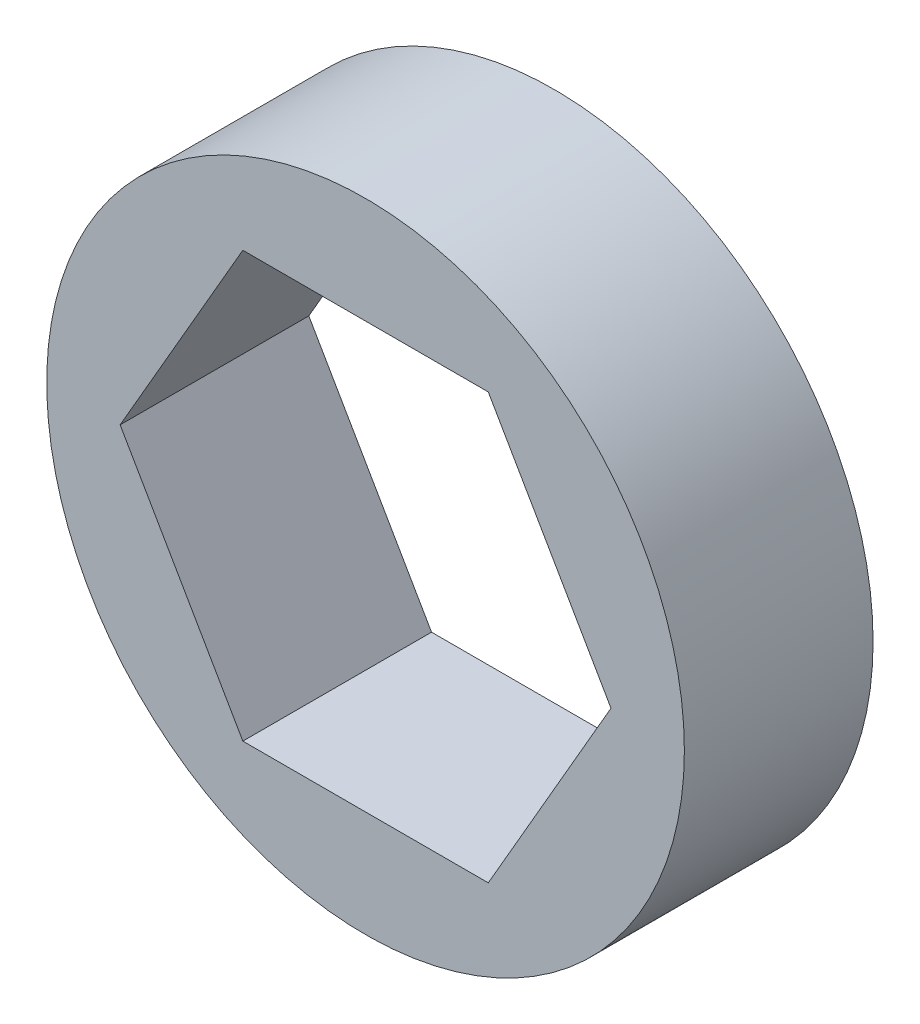
from build123d import *

# Parameters (mm, degrees)
SKETCH1_R           = 9.525
BOSS_EXTRUDE1_DEPTH = 5.63753
CUT_EXTRUDE1_DEPTH  = 0.4


with BuildPart() as part:
    # Sketch1 → Boss-Extrude1 (new body)
    with BuildSketch(Plane.XY):
        Circle(SKETCH1_R)
        Polygon((3.666174209, 6.35), (-3.666174209, 6.35), (-7.332348419, 0), (-3.666174209, -6.35), (3.666174209, -6.35), (7.332348419, 0), align=None, mode=Mode.SUBTRACT)
    extrude(amount=BOSS_EXTRUDE1_DEPTH)

    # Sketch2 → Cut-Extrude1 (cut)
    # profile 1 of 4: a face of its own
    with BuildSketch(Plane(origin=(0, 0, 0), x_dir=(-1, 0, 0), z_dir=(0, 0, -1))):
        with BuildLine():
            add(Edge.make_bspline(
                [(-2.473143607, 7.778113982), (-2.472994827, 7.803558155), (-2.472705821, 7.852983826), (-2.469490715, 7.925004003), (-2.464149757, 7.992568134), (-2.456830305, 8.055679453), (-2.447923079, 8.114354254), (-2.436032483, 8.168435733), (-2.422510247, 8.218174197), (-2.406838245, 8.263731841), (-2.389154498, 8.305722442), (-2.36990753, 8.344922444), (-2.348333498, 8.381272534), (-2.325665398, 8.415352889), (-2.300985637, 8.446605637), (-2.274996543, 8.47547213), (-2.246683763, 8.50128522), (-2.217009756, 8.524801222), (-2.18570586, 8.545415804), (-2.153664365, 8.56357351), (-2.120664727, 8.579085593), (-2.086616851, 8.591282326), (-2.051826763, 8.601356532), (-2.016172843, 8.608245804), (-1.979596225, 8.612580545), (-1.954907681, 8.612994959), (-1.942386896, 8.613205128)],
                knots=[0, 0, 0, 0, 1.646270934, 3.197905019, 4.663502075, 6.030701355, 7.308322542, 8.50163776, 9.611534131, 10.641858119, 11.616356847, 12.558055219, 13.465016945, 14.349605745, 15.204443733, 16.039544428, 16.859896111, 17.680448484, 18.487036065, 19.28249412, 20.06191084, 20.843045899, 21.620316918, 22.403196591, 23.190181807, 24, 24, 24, 24], degree=3))
            add(Edge.make_bspline(
                [(-1.942386896, 8.613205128), (-1.929761518, 8.612983869), (-1.904653614, 8.612543855), (-1.867533158, 8.608314781), (-1.831270267, 8.601297521), (-1.79601954, 8.591354793), (-1.761491421, 8.579019612), (-1.727955979, 8.563558669), (-1.69520491, 8.545561469), (-1.663758672, 8.52441421), (-1.633272043, 8.500836535), (-1.60449386, 8.474183467), (-1.577421503, 8.44472413), (-1.551715204, 8.412773713), (-1.528104272, 8.377719407), (-1.50561918, 8.3401709), (-1.485493292, 8.299471543), (-1.466110064, 8.256300403), (-1.449379181, 8.209462957), (-1.434290563, 8.159223227), (-1.422099031, 8.104987792), (-1.411943896, 8.047041209), (-1.404076747, 7.985170672), (-1.398346942, 7.919508808), (-1.395320221, 7.850012416), (-1.394750217, 7.802497249), (-1.394457709, 7.778113982)],
                knots=[0, 0, 0, 0, 0.810914788, 1.612654377, 2.396697861, 3.181598691, 3.963628158, 4.749916497, 5.551656086, 6.361998678, 7.18212741, 8.025565596, 8.878627764, 9.750805457, 10.657531673, 11.591944965, 12.560506719, 13.57287815, 14.630710178, 15.753379473, 16.941251878, 18.199788006, 19.531962791, 20.947069417, 22.433333509, 24, 24, 24, 24], degree=3))
            add(Edge.make_bspline(
                [(-1.394457709, 7.778113982), (-1.39475325, 7.753837067), (-1.395329097, 7.706534487), (-1.398313011, 7.637350795), (-1.404190676, 7.572037397), (-1.411543063, 7.510437651), (-1.421726179, 7.452807946), (-1.434247093, 7.398948857), (-1.448149204, 7.348627795), (-1.465309986, 7.302257006), (-1.484092701, 7.259189617), (-1.50452845, 7.218972732), (-1.526422264, 7.181250878), (-1.550275017, 7.146325993), (-1.575699243, 7.113950673), (-1.603239097, 7.084696394), (-1.632118256, 7.057858268), (-1.662694601, 7.033976994), (-1.694631269, 7.013074244), (-1.727269851, 6.994380819), (-1.761189457, 6.979307418), (-1.795621403, 6.966364738), (-1.831058198, 6.956476676), (-1.867455668, 6.949639606), (-1.904628675, 6.944844518), (-1.929757242, 6.944478722), (-1.942386896, 6.944294872)],
                knots=[0, 0, 0, 0, 1.561518951, 3.042555995, 4.452378317, 5.7783523, 7.031515105, 8.214008947, 9.334062868, 10.386615937, 11.391082383, 12.354592575, 13.286541444, 14.194233754, 15.072674879, 15.931287219, 16.775624067, 17.606195743, 18.42308326, 19.229000347, 20.022332153, 20.807536673, 21.593273796, 22.3848459, 23.188221202, 24, 24, 24, 24], degree=3))
            add(Edge.make_bspline(
                [(-1.942386896, 6.944294872), (-1.954907334, 6.944506397), (-1.979595192, 6.944923484), (-2.016176828, 6.949238641), (-2.051683508, 6.956176244), (-2.086290443, 6.965890204), (-2.120175183, 6.977780505), (-2.152875999, 6.99327164), (-2.184756484, 7.01111245), (-2.215731583, 7.031430373), (-2.245219242, 7.054708422), (-2.273385395, 7.080455082), (-2.299522457, 7.109312843), (-2.32384935, 7.140826044), (-2.34696974, 7.174704765), (-2.36823742, 7.211411562), (-2.387909201, 7.250800889), (-2.405890355, 7.293127227), (-2.421832785, 7.339008213), (-2.435915138, 7.388968733), (-2.44703406, 7.443449753), (-2.456551329, 7.502013702), (-2.464227745, 7.564912235), (-2.469468457, 7.632179499), (-2.472707554, 7.703773575), (-2.472995603, 7.752881652), (-2.473143607, 7.778113982)],
                knots=[0, 0, 0, 0, 0.810891512, 1.598919785, 2.382837074, 3.152667961, 3.926044502, 4.706494248, 5.493654104, 6.291793342, 7.103789334, 7.925228297, 8.761435821, 9.622817696, 10.50288917, 11.416980706, 12.369136599, 13.353924996, 14.394355917, 15.514179734, 16.714354668, 17.994756427, 19.357759367, 20.818452758, 22.365282078, 24, 24, 24, 24], degree=3))
        make_face()
        with BuildLine():
            add(Edge.make_bspline(
                [(-2.330675658, 7.77875), (-2.33062148, 7.757546126), (-2.330516332, 7.71639357), (-2.327769412, 7.656593234), (-2.324027343, 7.600817406), (-2.319200755, 7.548995266), (-2.312032989, 7.501302225), (-2.304001696, 7.457410261), (-2.294228098, 7.417551657), (-2.282664286, 7.3814529), (-2.269492981, 7.348501359), (-2.255112108, 7.317839379), (-2.239663137, 7.289104751), (-2.222373379, 7.262555578), (-2.203543333, 7.238105282), (-2.183598319, 7.215321105), (-2.161793968, 7.195002474), (-2.13162977, 7.170633508), (-2.091807798, 7.145451615), (-2.04163352, 7.12352321), (-1.990076759, 7.109742596), (-1.955083156, 7.107990106), (-1.937616764, 7.107115385)],
                knots=[0, 0, 0, 0, 1.459021318, 2.831673884, 4.118529203, 5.306027144, 6.411944654, 7.436330062, 8.375795394, 9.233974572, 10.042671642, 10.816086306, 11.563610507, 12.285937304, 12.993564865, 13.685989202, 14.367179055, 15.041617293, 16.353048772, 17.594441528, 18.799311195, 20, 20, 20, 20], degree=3))
            add(Edge.make_bspline(
                [(-1.937616764, 7.107115385), (-1.920037391, 7.107840092), (-1.884914941, 7.109288012), (-1.833600684, 7.123257439), (-1.783784812, 7.144334694), (-1.744745039, 7.169257313), (-1.715044028, 7.192991948), (-1.693763822, 7.213227878), (-1.674232107, 7.235886432), (-1.655707309, 7.260333612), (-1.638716942, 7.287036489), (-1.623266876, 7.315866657), (-1.609168358, 7.346904177), (-1.601136041, 7.368571166), (-1.597029324, 7.379648938)],
                knots=[0, 0, 0, 0, 1.353760809, 2.704726607, 4.075137775, 5.516104923, 6.260822281, 7.007110065, 7.778089737, 8.566572457, 9.372053459, 10.217411131, 11.088608312, 12, 12, 12, 12], degree=3))
            add(Edge.make_bspline(
                [(-1.597029324, 7.379648938), (-1.592243344, 7.393813856), (-1.582525751, 7.422574713), (-1.570001839, 7.467189655), (-1.560138747, 7.51399948), (-1.551265363, 7.562724444), (-1.545208799, 7.61372388), (-1.540333898, 7.66683999), (-1.537462479, 7.722112822), (-1.537106538, 7.759666264), (-1.536925658, 7.77875)],
                knots=[0, 0, 0, 0, 0.884706709, 1.796334032, 2.740027952, 3.714592787, 4.726048262, 5.777819803, 6.87074269, 8, 8, 8, 8], degree=3))
            add(Edge.make_bspline(
                [(-1.536925658, 7.77875), (-1.537175208, 7.797830649), (-1.537663382, 7.835156477), (-1.539529369, 7.889820081), (-1.544347919, 7.941739386), (-1.549699662, 7.991138065), (-1.557590544, 8.037742667), (-1.56609855, 8.081943341), (-1.5775291, 8.123192499), (-1.58973914, 8.162135952), (-1.603713855, 8.198331249), (-1.619097063, 8.231947145), (-1.635526218, 8.26314593), (-1.653370735, 8.291842007), (-1.672418777, 8.318163911), (-1.693173093, 8.341583888), (-1.714810434, 8.362827798), (-1.7451168, 8.387076892), (-1.784792639, 8.41180184), (-1.834161915, 8.434555595), (-1.885538243, 8.447622213), (-1.920269774, 8.449464479), (-1.937616764, 8.450384615)],
                knots=[0, 0, 0, 0, 1.31362396, 2.569729283, 3.763502607, 4.902122613, 5.988968491, 7.01645872, 7.998833611, 8.933434873, 9.825090667, 10.667526885, 11.477055099, 12.250526234, 12.991942729, 13.710640831, 14.402115721, 15.076753259, 16.378508321, 17.609869233, 18.806226677, 20, 20, 20, 20], degree=3))
            add(Edge.make_bspline(
                [(-1.937616764, 8.450384615), (-1.955174782, 8.449463209), (-1.990322806, 8.447618718), (-2.042233128, 8.434604278), (-2.091991888, 8.411919826), (-2.131562809, 8.386995), (-2.161890312, 8.363255837), (-2.183245676, 8.342669838), (-2.203269119, 8.320151716), (-2.221714825, 8.295476562), (-2.238991036, 8.268958341), (-2.254857424, 8.240388437), (-2.269152784, 8.209622069), (-2.282344699, 8.176685328), (-2.293943785, 8.140589686), (-2.303511404, 8.100780178), (-2.312350174, 8.05702782), (-2.318607314, 8.009076471), (-2.324169803, 7.957241352), (-2.327744558, 7.901326283), (-2.330525521, 7.841425653), (-2.33062461, 7.80006032), (-2.330675658, 7.77875)],
                knots=[0, 0, 0, 0, 1.207732386, 2.417664972, 3.655092373, 4.956220595, 5.625982001, 6.301752483, 6.994047911, 7.697131622, 8.419323945, 9.170223765, 9.943494443, 10.752040957, 11.610060368, 12.549350801, 13.567764191, 14.679664412, 15.874934091, 17.154273443, 18.533957287, 20, 20, 20, 20], degree=3))
        make_face(mode=Mode.SUBTRACT)
    # profile 2 of 4: a face of its own
    with BuildSketch(Plane(origin=(0, 0, 0), x_dir=(-1, 0, 0), z_dir=(0, 0, -1))):
        with BuildLine():
            add(Edge.make_bspline(
                [(-1.251989761, 7.778113982), (-1.251840981, 7.803558155), (-1.251551974, 7.852983826), (-1.248336869, 7.925004003), (-1.24299591, 7.992568134), (-1.235676459, 8.055679453), (-1.226769232, 8.114354254), (-1.214878637, 8.168435733), (-1.201356401, 8.218174197), (-1.185684399, 8.263731841), (-1.168000652, 8.305722442), (-1.148753684, 8.344922444), (-1.127179652, 8.381272534), (-1.104511552, 8.415352889), (-1.079831791, 8.446605637), (-1.053842697, 8.47547213), (-1.025529917, 8.50128522), (-0.99585591, 8.524801222), (-0.964552013, 8.545415804), (-0.932510518, 8.56357351), (-0.899510881, 8.579085593), (-0.865463005, 8.591282326), (-0.830672917, 8.601356532), (-0.795018997, 8.608245804), (-0.758442378, 8.612580545), (-0.733753835, 8.612994959), (-0.72123305, 8.613205128)],
                knots=[0, 0, 0, 0, 1.646270934, 3.197905019, 4.663502075, 6.030701355, 7.308322542, 8.50163776, 9.611534131, 10.641858119, 11.616356847, 12.558055219, 13.465016945, 14.349605745, 15.204443733, 16.039544428, 16.859896111, 17.680448484, 18.487036065, 19.28249412, 20.06191084, 20.843045899, 21.620316918, 22.403196591, 23.190181807, 24, 24, 24, 24], degree=3))
            add(Edge.make_bspline(
                [(-0.72123305, 8.613205128), (-0.708607672, 8.612983869), (-0.683499768, 8.612543855), (-0.646379312, 8.608314781), (-0.610116421, 8.601297521), (-0.574865694, 8.591354793), (-0.540337575, 8.579019612), (-0.506802133, 8.563558669), (-0.474051064, 8.545561469), (-0.442604826, 8.52441421), (-0.412118197, 8.500836535), (-0.383340014, 8.474183467), (-0.356267657, 8.44472413), (-0.330561358, 8.412773713), (-0.306950426, 8.377719407), (-0.284465334, 8.3401709), (-0.264339446, 8.299471543), (-0.244956218, 8.256300403), (-0.228225335, 8.209462957), (-0.213136717, 8.159223227), (-0.200945184, 8.104987792), (-0.19079005, 8.047041209), (-0.182922901, 7.985170672), (-0.177193095, 7.919508808), (-0.174166375, 7.850012416), (-0.173596371, 7.802497249), (-0.173303863, 7.778113982)],
                knots=[0, 0, 0, 0, 0.810914788, 1.612654377, 2.396697861, 3.181598691, 3.963628158, 4.749916497, 5.551656086, 6.361998678, 7.18212741, 8.025565596, 8.878627764, 9.750805457, 10.657531673, 11.591944965, 12.560506719, 13.57287815, 14.630710178, 15.753379473, 16.941251878, 18.199788006, 19.531962791, 20.947069417, 22.433333509, 24, 24, 24, 24], degree=3))
            add(Edge.make_bspline(
                [(-0.173303863, 7.778113982), (-0.173599403, 7.753837067), (-0.174175251, 7.706534487), (-0.177159165, 7.637350795), (-0.18303683, 7.572037397), (-0.190389217, 7.510437651), (-0.200572333, 7.452807946), (-0.213093247, 7.398948857), (-0.226995358, 7.348627795), (-0.24415614, 7.302257006), (-0.262938855, 7.259189617), (-0.283374604, 7.218972732), (-0.305268418, 7.181250878), (-0.32912117, 7.146325993), (-0.354545397, 7.113950673), (-0.382085251, 7.084696394), (-0.41096441, 7.057858268), (-0.441540755, 7.033976994), (-0.473477423, 7.013074244), (-0.506116005, 6.994380819), (-0.540035611, 6.979307418), (-0.574467557, 6.966364738), (-0.609904352, 6.956476676), (-0.646301822, 6.949639606), (-0.683474829, 6.944844518), (-0.708603396, 6.944478722), (-0.72123305, 6.944294872)],
                knots=[0, 0, 0, 0, 1.561518951, 3.042555995, 4.452378317, 5.7783523, 7.031515105, 8.214008947, 9.334062868, 10.386615937, 11.391082383, 12.354592575, 13.286541444, 14.194233754, 15.072674879, 15.931287219, 16.775624067, 17.606195743, 18.42308326, 19.229000347, 20.022332153, 20.807536673, 21.593273796, 22.3848459, 23.188221202, 24, 24, 24, 24], degree=3))
            add(Edge.make_bspline(
                [(-0.72123305, 6.944294872), (-0.733753487, 6.944506397), (-0.758441346, 6.944923484), (-0.795022982, 6.949238641), (-0.830529662, 6.956176244), (-0.865136597, 6.965890204), (-0.899021337, 6.977780505), (-0.931722153, 6.99327164), (-0.963602638, 7.01111245), (-0.994577737, 7.031430373), (-1.024065396, 7.054708422), (-1.052231549, 7.080455082), (-1.078368611, 7.109312843), (-1.102695504, 7.140826044), (-1.125815894, 7.174704765), (-1.147083574, 7.211411562), (-1.166755355, 7.250800889), (-1.184736509, 7.293127227), (-1.200678939, 7.339008213), (-1.214761292, 7.388968733), (-1.225880213, 7.443449753), (-1.235397483, 7.502013702), (-1.243073899, 7.564912235), (-1.248314611, 7.632179499), (-1.251553707, 7.703773575), (-1.251841757, 7.752881652), (-1.251989761, 7.778113982)],
                knots=[0, 0, 0, 0, 0.810891512, 1.598919785, 2.382837074, 3.152667961, 3.926044502, 4.706494248, 5.493654104, 6.291793342, 7.103789334, 7.925228297, 8.761435821, 9.622817696, 10.50288917, 11.416980706, 12.369136599, 13.353924996, 14.394355917, 15.514179734, 16.714354668, 17.994756427, 19.357759367, 20.818452758, 22.365282078, 24, 24, 24, 24], degree=3))
        make_face()
        with BuildLine():
            add(Edge.make_bspline(
                [(-1.109521812, 7.77875), (-1.109467634, 7.757546126), (-1.109362486, 7.71639357), (-1.106615566, 7.656593234), (-1.102873497, 7.600817406), (-1.098046908, 7.548995266), (-1.090879142, 7.501302225), (-1.082847849, 7.457410261), (-1.073074252, 7.417551657), (-1.06151044, 7.3814529), (-1.048339135, 7.348501359), (-1.033958261, 7.317839379), (-1.018509291, 7.289104751), (-1.001219533, 7.262555578), (-0.982389487, 7.238105282), (-0.962444473, 7.215321105), (-0.940640122, 7.195002474), (-0.910475924, 7.170633508), (-0.870653952, 7.145451615), (-0.820479674, 7.12352321), (-0.768922912, 7.109742596), (-0.73392931, 7.107990106), (-0.716462918, 7.107115385)],
                knots=[0, 0, 0, 0, 1.459021318, 2.831673884, 4.118529203, 5.306027144, 6.411944654, 7.436330062, 8.375795394, 9.233974572, 10.042671642, 10.816086306, 11.563610507, 12.285937304, 12.993564865, 13.685989202, 14.367179055, 15.041617293, 16.353048772, 17.594441528, 18.799311195, 20, 20, 20, 20], degree=3))
            add(Edge.make_bspline(
                [(-0.716462918, 7.107115385), (-0.698883545, 7.107840092), (-0.663761095, 7.109288012), (-0.612446838, 7.123257439), (-0.562630966, 7.144334694), (-0.523591193, 7.169257313), (-0.493890182, 7.192991948), (-0.472609976, 7.213227878), (-0.453078261, 7.235886432), (-0.434553463, 7.260333612), (-0.417563096, 7.287036489), (-0.40211303, 7.315866657), (-0.388014512, 7.346904177), (-0.379982194, 7.368571166), (-0.375875478, 7.379648938)],
                knots=[0, 0, 0, 0, 1.353760809, 2.704726607, 4.075137775, 5.516104923, 6.260822281, 7.007110065, 7.778089737, 8.566572457, 9.372053459, 10.217411131, 11.088608312, 12, 12, 12, 12], degree=3))
            add(Edge.make_bspline(
                [(-0.375875478, 7.379648938), (-0.371089497, 7.393813856), (-0.361371905, 7.422574713), (-0.348847993, 7.467189655), (-0.338984901, 7.51399948), (-0.330111517, 7.562724444), (-0.324054953, 7.61372388), (-0.319180052, 7.66683999), (-0.316308633, 7.722112822), (-0.315952692, 7.759666264), (-0.315771812, 7.77875)],
                knots=[0, 0, 0, 0, 0.884706709, 1.796334032, 2.740027952, 3.714592787, 4.726048262, 5.777819803, 6.87074269, 8, 8, 8, 8], degree=3))
            add(Edge.make_bspline(
                [(-0.315771812, 7.77875), (-0.316021362, 7.797830649), (-0.316509535, 7.835156477), (-0.318375523, 7.889820081), (-0.323194073, 7.941739386), (-0.328545816, 7.991138065), (-0.336436698, 8.037742667), (-0.344944704, 8.081943341), (-0.356375253, 8.123192499), (-0.368585294, 8.162135952), (-0.382560009, 8.198331249), (-0.397943217, 8.231947145), (-0.414372372, 8.26314593), (-0.432216888, 8.291842007), (-0.45126493, 8.318163911), (-0.472019247, 8.341583888), (-0.493656588, 8.362827798), (-0.523962954, 8.387076892), (-0.563638793, 8.41180184), (-0.613008069, 8.434555595), (-0.664384397, 8.447622213), (-0.699115928, 8.449464479), (-0.716462918, 8.450384615)],
                knots=[0, 0, 0, 0, 1.31362396, 2.569729283, 3.763502607, 4.902122613, 5.988968491, 7.01645872, 7.998833611, 8.933434873, 9.825090667, 10.667526885, 11.477055099, 12.250526234, 12.991942729, 13.710640831, 14.402115721, 15.076753259, 16.378508321, 17.609869233, 18.806226677, 20, 20, 20, 20], degree=3))
            add(Edge.make_bspline(
                [(-0.716462918, 8.450384615), (-0.734020936, 8.449463209), (-0.76916896, 8.447618718), (-0.821079282, 8.434604278), (-0.870838042, 8.411919826), (-0.910408962, 8.386995), (-0.940736466, 8.363255837), (-0.96209183, 8.342669838), (-0.982115272, 8.320151716), (-1.000560979, 8.295476562), (-1.01783719, 8.268958341), (-1.033703578, 8.240388437), (-1.047998938, 8.209622069), (-1.061190853, 8.176685328), (-1.072789939, 8.140589686), (-1.082357558, 8.100780178), (-1.091196328, 8.05702782), (-1.097453468, 8.009076471), (-1.103015957, 7.957241352), (-1.106590711, 7.901326283), (-1.109371675, 7.841425653), (-1.109470764, 7.80006032), (-1.109521812, 7.77875)],
                knots=[0, 0, 0, 0, 1.207732386, 2.417664972, 3.655092373, 4.956220595, 5.625982001, 6.301752483, 6.994047911, 7.697131622, 8.419323945, 9.170223765, 9.943494443, 10.752040957, 11.610060368, 12.549350801, 13.567764191, 14.679664412, 15.874934091, 17.154273443, 18.533957287, 20, 20, 20, 20], degree=3))
        make_face(mode=Mode.SUBTRACT)
    # profile 3 of 4: a face of its own
    with BuildSketch(Plane(origin=(0, 0, 0), x_dir=(-1, 0, 0), z_dir=(0, 0, -1))):
        Polygon((0.835738104, 8.613205128), (0.864676906, 8.613205128), (0.864676906, 7.514166667), (1.047849983, 7.514166667), (1.047849983, 7.351346154), (0.864676906, 7.351346154), (0.864676906, 6.985), (0.722208957, 6.985), (0.722208957, 7.351346154), (-0.030835915, 7.351346154), align=None)
        Polygon((0.722208957, 7.514166667), (0.722208957, 8.203609776), (0.249011842, 7.514166667), align=None, mode=Mode.SUBTRACT)
    # profile 4 of 4: a face of its own
    with BuildSketch(Plane(origin=(0, 0, 0), x_dir=(-1, 0, 0), z_dir=(0, 0, -1))):
        with BuildLine():
            add(Edge.make_bspline(
                [(1.962125323, 7.869382512), (1.975119486, 7.862607082), (2.000462442, 7.849392731), (2.03655639, 7.82811532), (2.069542373, 7.80569031), (2.100335592, 7.783176903), (2.12839504, 7.759712904), (2.153406971, 7.735205008), (2.175989213, 7.710264954), (2.195686361, 7.68447042), (2.213011355, 7.657889932), (2.227984716, 7.630453726), (2.240783233, 7.602221928), (2.250926423, 7.572886366), (2.259282022, 7.542877962), (2.265031314, 7.511809234), (2.268123273, 7.479884908), (2.268707842, 7.458309286), (2.269003829, 7.447384816)],
                knots=[0, 0, 0, 0, 1.272397273, 2.481599622, 3.635517121, 4.734568067, 5.792894095, 6.808321871, 7.773003508, 8.711915296, 9.623354172, 10.525449501, 11.423591555, 12.311487226, 13.218079475, 14.126165749, 15.051214107, 16, 16, 16, 16], degree=3))
            add(Edge.make_bspline(
                [(2.269003829, 7.447384816), (2.268653935, 7.432100487), (2.267961363, 7.401847066), (2.26192887, 7.357194722), (2.252896912, 7.31382795), (2.239707276, 7.271756256), (2.222601559, 7.23121179), (2.201520994, 7.192159846), (2.177658055, 7.153960374), (2.158493646, 7.130456574), (2.148796497, 7.118563702)],
                knots=[0, 0, 0, 0, 1.025265484, 2.029385089, 3.018602448, 3.995076438, 4.983346944, 5.966715145, 6.97116228, 8, 8, 8, 8], degree=3))
            add(Edge.make_bspline(
                [(2.148796497, 7.118563702), (2.136170668, 7.10468724), (2.11107503, 7.077105792), (2.068084202, 7.04129596), (2.020902848, 7.01120177), (1.969713532, 6.986676304), (1.91465309, 6.967587361), (1.855733252, 6.953870219), (1.792839154, 6.94601326), (1.749611316, 6.944877522), (1.727434819, 6.944294872)],
                knots=[0, 0, 0, 0, 0.954267603, 1.896743057, 2.838368354, 3.796610408, 4.779680527, 5.799409237, 6.871065594, 8, 8, 8, 8], degree=3))
            add(Edge.make_bspline(
                [(1.727434819, 6.944294872), (1.706110889, 6.944817603), (1.664616687, 6.945834784), (1.604220078, 6.952726544), (1.5479214, 6.964804184), (1.495393308, 6.981334418), (1.446952472, 7.002838343), (1.402736922, 7.029602871), (1.362108728, 7.060550703), (1.326300863, 7.09657066), (1.294510747, 7.135150481), (1.266585237, 7.174952104), (1.243374138, 7.215979163), (1.223722205, 7.257619908), (1.208678138, 7.300457985), (1.198258599, 7.344272991), (1.191641303, 7.388988395), (1.19076086, 7.419165252), (1.190317932, 7.434346454)],
                knots=[0, 0, 0, 0, 1.256902934, 2.445805442, 3.576955095, 4.645999104, 5.686449165, 6.692658513, 7.68621702, 8.689161843, 9.678783111, 10.630372946, 11.551080876, 12.453998257, 13.34127905, 14.221779781, 15.105423033, 16, 16, 16, 16], degree=3))
            add(Edge.make_bspline(
                [(1.190317932, 7.434346454), (1.190580042, 7.445485802), (1.191098064, 7.467501085), (1.194683478, 7.500026388), (1.200447673, 7.53168392), (1.208276069, 7.562590615), (1.21888557, 7.592521463), (1.231695395, 7.621618285), (1.246632388, 7.64991393), (1.263904916, 7.677563137), (1.283999049, 7.704178487), (1.306751847, 7.73021167), (1.332618059, 7.755258732), (1.361309925, 7.779625689), (1.392499556, 7.803744791), (1.426997079, 7.826312568), (1.463887979, 7.848926716), (1.490106859, 7.862446921), (1.503556613, 7.869382512)],
                knots=[0, 0, 0, 0, 0.941657376, 1.861047343, 2.762797495, 3.66048619, 4.553285746, 5.444104102, 6.34607688, 7.256116206, 8.197091036, 9.162375105, 10.176350973, 11.237807142, 12.343728897, 13.50695164, 14.721116704, 16, 16, 16, 16], degree=3))
            add(Edge.make_bspline(
                [(1.503556613, 7.869382512), (1.485145526, 7.879422211), (1.449496506, 7.898861877), (1.402293581, 7.934579179), (1.361748549, 7.973263295), (1.328975873, 8.015731094), (1.303180255, 8.060655927), (1.285482531, 8.107756713), (1.27350984, 8.156160093), (1.272323829, 8.18922826), (1.271728188, 8.205835837)],
                knots=[0, 0, 0, 0, 1.166880483, 2.259407225, 3.286803203, 4.280235371, 5.237608625, 6.161067461, 7.076446754, 8, 8, 8, 8], degree=3))
            add(Edge.make_bspline(
                [(1.271728188, 8.205835837), (1.27246997, 8.222752944), (1.27396108, 8.256759279), (1.286018515, 8.307380628), (1.305667259, 8.35709957), (1.33239214, 8.405675125), (1.365678485, 8.451463259), (1.405613882, 8.492530045), (1.451244663, 8.528503467), (1.502343053, 8.558700517), (1.557332345, 8.583276677), (1.615351263, 8.600230461), (1.675388922, 8.611313986), (1.716254674, 8.612568861), (1.736975083, 8.613205128)],
                knots=[0, 0, 0, 0, 0.888701115, 1.786444228, 2.72001202, 3.692817113, 4.693886446, 5.687152267, 6.695133018, 7.739871481, 8.800368666, 9.853104506, 10.91144658, 12, 12, 12, 12], degree=3))
            add(Edge.make_bspline(
                [(1.736975083, 8.613205128), (1.757160742, 8.612549108), (1.796964562, 8.611255512), (1.855472839, 8.600466464), (1.911454837, 8.582446288), (1.964717503, 8.558000048), (2.014307314, 8.527888828), (2.058123362, 8.491421289), (2.096827783, 8.450535657), (2.128842847, 8.404761408), (2.155223872, 8.356372506), (2.173593924, 8.30574372), (2.185364998, 8.253968968), (2.186849702, 8.218936017), (2.187593573, 8.201383714)],
                knots=[0, 0, 0, 0, 1.072916533, 2.115669174, 3.151510826, 4.193348718, 5.225979165, 6.227137561, 7.216255879, 8.211077061, 9.189680878, 10.138522389, 11.067357538, 12, 12, 12, 12], degree=3))
            add(Edge.make_bspline(
                [(2.187593573, 8.201383714), (2.186942897, 8.184158584), (2.185665007, 8.150329409), (2.174915391, 8.101014165), (2.156811853, 8.054830598), (2.132094857, 8.011254652), (2.099879725, 7.971076615), (2.060596479, 7.933785573), (2.014558308, 7.899075191), (1.979968549, 7.87948709), (1.962125323, 7.869382512)],
                knots=[0, 0, 0, 0, 0.975232327, 1.915300861, 2.843280834, 3.77672583, 4.742871857, 5.749627742, 6.839139064, 8, 8, 8, 8], degree=3))
        make_face()
        with BuildLine():
            add(Edge.make_bspline(
                [(1.729024863, 8.450384615), (1.717889319, 8.450089141), (1.696103325, 8.449511063), (1.664158892, 8.446490895), (1.63378214, 8.440615686), (1.604655688, 8.432796699), (1.577178869, 8.422233933), (1.550978518, 8.40980834), (1.526500542, 8.39470166), (1.503449451, 8.377755688), (1.482698207, 8.35911712), (1.464281143, 8.33969804), (1.448983034, 8.319117059), (1.435992245, 8.297886124), (1.426566342, 8.275375113), (1.419506819, 8.252274186), (1.414734616, 8.228291423), (1.414377025, 8.211900934), (1.414196137, 8.203609776)],
                knots=[0, 0, 0, 0, 1.203892937, 2.355340988, 3.463153438, 4.544400666, 5.610487187, 6.640501085, 7.674077295, 8.714426146, 9.728707835, 10.68524104, 11.601827946, 12.495867327, 13.368432065, 14.231010473, 15.105153427, 16, 16, 16, 16], degree=3))
            add(Edge.make_bspline(
                [(1.414196137, 8.203609776), (1.414507907, 8.195318259), (1.415124009, 8.17893303), (1.419888835, 8.15473687), (1.426990337, 8.130959913), (1.438171173, 8.108167536), (1.451581628, 8.085569083), (1.468133119, 8.063729353), (1.487858499, 8.042572339), (1.510095946, 8.022277993), (1.534321893, 8.003273911), (1.559986798, 7.986776075), (1.586768555, 7.972972032), (1.614391993, 7.961483338), (1.643138646, 7.952552545), (1.672832368, 7.946216766), (1.703478149, 7.94227886), (1.724242913, 7.941808497), (1.734749021, 7.941570513)],
                knots=[0, 0, 0, 0, 0.873023192, 1.725219244, 2.590779336, 3.480155217, 4.391973325, 5.357036234, 6.360879153, 7.436073238, 8.526419356, 9.601555421, 10.645666583, 11.697338044, 12.750135903, 13.812665442, 14.89329948, 16, 16, 16, 16], degree=3))
            add(Edge.make_bspline(
                [(1.734749021, 7.941570513), (1.748242818, 7.94196642), (1.775097135, 7.942754325), (1.814684546, 7.950080036), (1.853175817, 7.961603435), (1.890159534, 7.977369562), (1.9246784, 7.997157913), (1.955448717, 8.020849318), (1.982208022, 8.047896733), (2.004678227, 8.077879091), (2.022099836, 8.109788561), (2.035662442, 8.141810837), (2.04358235, 8.174287563), (2.044615389, 8.196044007), (2.045125624, 8.206789864)],
                knots=[0, 0, 0, 0, 1.076279235, 2.141928126, 3.20205304, 4.278698113, 5.344010996, 6.36967002, 7.368914609, 8.37248503, 9.349703398, 10.264243087, 11.142681841, 12, 12, 12, 12], degree=3))
            add(Edge.make_bspline(
                [(2.045125624, 8.206789864), (2.04488437, 8.214331866), (2.044405517, 8.229301659), (2.04045942, 8.251407989), (2.033938953, 8.273011407), (2.025111056, 8.29429038), (2.013495184, 8.314946355), (1.999722857, 8.335304041), (1.982993101, 8.354905477), (1.964216861, 8.374207458), (1.942923765, 8.392070926), (1.919154848, 8.407780241), (1.893031968, 8.421120845), (1.864554509, 8.431956102), (1.833827347, 8.440094239), (1.800992007, 8.446188582), (1.765774704, 8.449623529), (1.741540496, 8.450125418), (1.729024863, 8.450384615)],
                knots=[0, 0, 0, 0, 0.814439003, 1.616544685, 2.417341072, 3.248991801, 4.09997495, 4.973547432, 5.9003056, 6.880240646, 7.880314356, 8.896779544, 9.951930927, 11.043077905, 12.18215768, 13.381699519, 14.647792085, 16, 16, 16, 16], degree=3))
        make_face(mode=Mode.SUBTRACT)
        with BuildLine():
            add(Edge.make_bspline(
                [(1.738247118, 7.77875), (1.724129351, 7.778498884), (1.696433737, 7.778006256), (1.65585863, 7.772522804), (1.616918088, 7.764889472), (1.579743402, 7.753309413), (1.544350272, 7.738252434), (1.510547099, 7.720139267), (1.478592479, 7.698728227), (1.448927671, 7.674291334), (1.421838875, 7.647957224), (1.398072503, 7.620079756), (1.377889699, 7.591177035), (1.361636761, 7.560881989), (1.348296439, 7.529836108), (1.339536216, 7.497266234), (1.333920226, 7.463798508), (1.333166104, 7.441047321), (1.33278588, 7.429576322)],
                knots=[0, 0, 0, 0, 1.140299081, 2.23698856, 3.303958914, 4.344563908, 5.37730929, 6.408454204, 7.439741482, 8.480804886, 9.510774543, 10.48932336, 11.43758569, 12.353841022, 13.263987381, 14.161954604, 15.073269652, 16, 16, 16, 16], degree=3))
            add(Edge.make_bspline(
                [(1.33278588, 7.429576322), (1.333404216, 7.415320161), (1.334630978, 7.387036271), (1.344363096, 7.345233735), (1.359982072, 7.304765614), (1.381764937, 7.265961692), (1.408737729, 7.229698608), (1.441905806, 7.198089771), (1.4792079, 7.170003957), (1.521906141, 7.147288858), (1.568546195, 7.129148335), (1.619115658, 7.116649737), (1.672888782, 7.108375937), (1.710017954, 7.10754219), (1.729024863, 7.107115385)],
                knots=[0, 0, 0, 0, 0.898778495, 1.783155532, 2.693654817, 3.627872908, 4.583023416, 5.533784346, 6.509005473, 7.520592997, 8.575161974, 9.658835044, 10.801527049, 12, 12, 12, 12], degree=3))
            add(Edge.make_bspline(
                [(1.729024863, 7.107115385), (1.743879494, 7.107400594), (1.772821079, 7.107956274), (1.815042206, 7.112861329), (1.854885983, 7.120639908), (1.892275145, 7.131953588), (1.927628244, 7.145764828), (1.960345872, 7.163532165), (1.991269704, 7.183739825), (2.018875931, 7.207714775), (2.044018851, 7.23333226), (2.065941452, 7.260451315), (2.084972198, 7.288334906), (2.099908739, 7.317613161), (2.111849575, 7.347724369), (2.120432759, 7.37894619), (2.125728757, 7.411374385), (2.126264377, 7.433372178), (2.12653588, 7.444522736)],
                knots=[0, 0, 0, 0, 1.224942928, 2.386581632, 3.501229538, 4.569074225, 5.605009692, 6.626002462, 7.634866581, 8.645888296, 9.63523824, 10.59253846, 11.518950513, 12.414518923, 13.29783783, 14.186679152, 15.080837789, 16, 16, 16, 16], degree=3))
            add(Edge.make_bspline(
                [(2.12653588, 7.444522736), (2.126125013, 7.455352816), (2.125314855, 7.476707841), (2.120172856, 7.508351944), (2.111139583, 7.538923935), (2.098744657, 7.568791616), (2.082243292, 7.597349811), (2.062810083, 7.625342503), (2.039363107, 7.651992748), (2.012868823, 7.677507545), (1.983994937, 7.701100397), (1.953303053, 7.721971232), (1.921029422, 7.739548084), (1.887242337, 7.753843066), (1.852016821, 7.765085954), (1.815378782, 7.772939995), (1.777285325, 7.777883743), (1.751406866, 7.778457986), (1.738247118, 7.77875)],
                knots=[0, 0, 0, 0, 0.917430815, 1.809013306, 2.70690318, 3.612392954, 4.541220862, 5.495268465, 6.494511384, 7.542276156, 8.608045339, 9.649016899, 10.681629292, 11.715607085, 12.752076957, 13.808767841, 14.885711793, 16, 16, 16, 16], degree=3))
        make_face(mode=Mode.SUBTRACT)
    extrude(amount=-CUT_EXTRUDE1_DEPTH, mode=Mode.SUBTRACT)


solid = part.part
